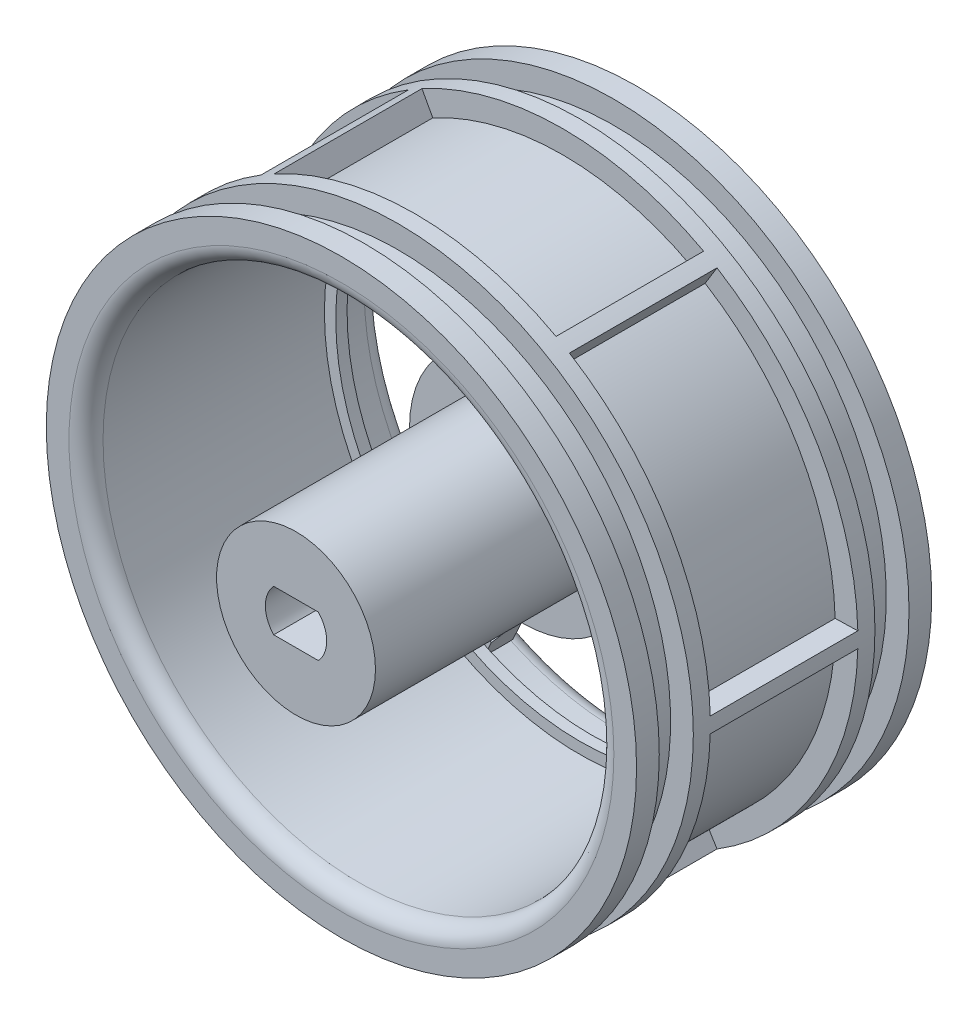
from build123d import *
from build123d.topology import SkipClean

# Parameters (mm, degrees)
CROQUIS5_W               = 1
CROQUIS5_H               = 1
CROQUIS6_W               = 13
CROQUIS6_H               = 2
CORTAR_REVOLUCI_N1_ANGLE = 57
MATRIZC1_COUNT           = 6
SALIENTE_EXTRUIR1_DEPTH  = 1.5
MATRIZC2_COUNT           = 5
REDONDEO2_R              = 5
CROQUIS9_R               = 10
SALIENTE_EXTRUIR2_DEPTH  = 8.5
CROQUIS10_R              = 9
CORTAR_EXTRUIR1_DEPTH    = 4
CROQUIS11_R              = 7
SALIENTE_EXTRUIR3_DEPTH  = 20
REVOLUCI_N3_ANGLE        = 22
MATRIZC3_COUNT           = 5
CORTAR_EXTRUIR3_START    = -1.5
CROQUIS15_R              = 22.5
CROQUIS15_R_2            = 22.3
CORTAR_EXTRUIR3_DEPTH    = 1.5
REDONDEO3_R              = 1.5
REDONDEO4_R              = 2
CORTAR_EXTRUIR2_DEPTH    = 20
CROQUIS16_R              = 5
SALIENTE_EXTRUIR4_DEPTH  = 2
REDONDEO6_R              = 0.5
CROQUIS17_R              = 0.75
SALIENTE_EXTRUIR5_DEPTH  = 2.5
SALIENTE_EXTRUIR5_TAPER  = 4
MATRIZC4_COUNT           = 4
REDONDEO7_R              = 2


# Some blends are built 0.0001 mm under size
with BuildPart() as part:
    # Croquis1 → Revolución1 (revolve)
    with BuildSketch(Plane(origin=(0, 0, 0), x_dir=(0, 0, -1), z_dir=(1, 0, 0)), mode=Mode.PRIVATE) as revoluci_n1_sk:
        Polygon((-13, 22.5), (-13, 26), (-11, 26), (-11, 24), (-8, 24), (-8, 26), (0, 26), (0, 22.5), align=None)
    revoluci_n1 = revolve(revoluci_n1_sk.sketch.rotate(Axis((0, 0, -0.65), (0, 0, 1)), 90), axis=Axis((0, 0, -0.65), (0, 0, 1)))

    # Simetría1: Revolución1 across plane
    add(revoluci_n1.mirror(Plane.XY))

    # Croquis5 → Revolución2 (revolve)
    with BuildSketch(Plane(origin=(0, 0, 0), x_dir=(0, 0, -1), z_dir=(1, 0, 0)), mode=Mode.PRIVATE) as revoluci_n2_sk:
        with Locations((8.5, 22)):
            Rectangle(CROQUIS5_W, CROQUIS5_H)
    revolve(revoluci_n2_sk.sketch.rotate(Axis((0, 0, -0.65), (0, 0, 1)), 90), axis=Axis((0, 0, -0.65), (0, 0, 1)))

    # Croquis6 → Cortar-Revolución1 (revolve, symmetric, cut)
    with BuildSketch(Plane(origin=(0, 0, 0), x_dir=(0, 0, -1), z_dir=(1, 0, 0))) as cortar_revoluci_n1_sk:
        with Locations((0, 25)):
            Rectangle(CROQUIS6_W, CROQUIS6_H)
    cortar_revoluci_n1 = revolve(axis=Axis((0, 0, -0.65), (0, 0, 1)), revolution_arc=CORTAR_REVOLUCI_N1_ANGLE / 2, mode=Mode.SUBTRACT)
    cortar_revoluci_n1 = cortar_revoluci_n1 + revolve(cortar_revoluci_n1_sk.sketch, axis=Axis((0, 0, -0.65), (0, 0, -1)), revolution_arc=CORTAR_REVOLUCI_N1_ANGLE / 2, mode=Mode.SUBTRACT)

    # MatrizC1: Cortar-Revolución1 ×6 about axis
    matrizc1_axis = Axis((0, 0, 0), (0, 0, 1))
    for i in range(1, MATRIZC1_COUNT):
        add(cortar_revoluci_n1.rotate(matrizc1_axis, i * 360 / MATRIZC1_COUNT), mode=Mode.SUBTRACT)

    # Croquis8 → Saliente-Extruir1 (add)
    with BuildSketch(Plane(origin=(0, 0, -13), x_dir=(-1, 0, 0), z_dir=(0, 0, -1))):
        Polygon((-4.421987, 0), (4.421987, 0), (3.5, 24), (-3.5, 24), align=None)
    saliente_extruir1 = extrude(amount=-SALIENTE_EXTRUIR1_DEPTH)

    # MatrizC2: Saliente-Extruir1 ×5 about axis
    matrizc2_axis = Axis((0, 0, 0), (0, 0, 1))
    for i in range(1, MATRIZC2_COUNT):
        add(saliente_extruir1.rotate(matrizc2_axis, i * 360 / MATRIZC2_COUNT))

    # Redondeo2
    redondeo2_edges = [part.edges().sort_by_distance(p)[0] for p in [
        (-4.199915382, 5.7806876, -12.25),
        (4.199915382, 5.7806876, -12.25),
        (-6.795605838, -2.208026185, -12.25),
        (0, -7.14532283, -12.25),
        (6.795605838, -2.208026185, -12.25),
    ]]
    fillet(redondeo2_edges, radius=REDONDEO2_R)

    # Croquis9 → Saliente-Extruir2 (add)
    with BuildSketch(Plane.XY.offset(-11.5)):
        with Locations(Location((0, 0, 0), (0, 0, 180))):
            Circle(CROQUIS9_R)
    extrude(amount=SALIENTE_EXTRUIR2_DEPTH)

    # Croquis10 → Cortar-Extruir1 (cut)
    with BuildSketch(Plane(origin=(0, 0, -13), x_dir=(-1, 0, 0), z_dir=(0, 0, -1))):
        Circle(CROQUIS10_R)
    extrude(amount=-CORTAR_EXTRUIR1_DEPTH, mode=Mode.SUBTRACT)

    # Croquis11 → Saliente-Extruir3 (add)
    with BuildSketch(Plane.XY.offset(-3)):
        Circle(CROQUIS11_R)
    extrude(amount=SALIENTE_EXTRUIR3_DEPTH)

    # Croquis14 → Revolución3 (revolve, symmetric)
    with BuildSketch(Plane(origin=(0, 0, 0), x_dir=(0, 0, -1), z_dir=(1, 0, 0))) as revoluci_n3_sk:
        with BuildLine():
            Line((9, 22.3), (11.5, 22.3))
            Line((11.5, 22.3), (11.5, 19.3))
            ThreePointArc((11.5, 19.3), (10.361757936, 20.236263226), (9, 20.8))
            Line((9, 20.8), (9, 22.3))
        make_face()
    revoluci_n3 = revolve(axis=Axis((0, 0, -0.65), (0, 0, 1)), revolution_arc=REVOLUCI_N3_ANGLE / 2)
    revoluci_n3 = revoluci_n3 + revolve(revoluci_n3_sk.sketch, axis=Axis((0, 0, -0.65), (0, 0, -1)), revolution_arc=REVOLUCI_N3_ANGLE / 2)

    # MatrizC3: Revolución3 ×5 about axis
    matrizc3_axis = Axis((0, 0, 0), (0, 0, 1))
    for i in range(1, MATRIZC3_COUNT):
        add(revoluci_n3.rotate(matrizc3_axis, i * 360 / MATRIZC3_COUNT))

    # Croquis15 → Cortar-Extruir3 (cut)
    with SkipClean():  # the faces are left unmerged after this step: merging them gives an invalid solid
        with BuildSketch(Plane(origin=(0, 0, -13), x_dir=(-1, 0, 0), z_dir=(0, 0, -1)).offset(CORTAR_EXTRUIR3_START)):
            Circle(CROQUIS15_R)
            Circle(CROQUIS15_R_2, mode=Mode.SUBTRACT)
        extrude(amount=CORTAR_EXTRUIR3_DEPTH, mode=Mode.SUBTRACT)

    # Redondeo3
    redondeo3_edges = [part.edges().sort_by_distance(p)[0] for p in [
        (22.5, 0, 13),
        (-20.796730424, -8.58754934, -13),
    ]]
    fillet(redondeo3_edges, radius=REDONDEO3_R - 0.0001)  # a hair under: the kernel refuses the full size

    # Redondeo4
    # the kernel refuses this fillet: 2 mm, written as the material it takes off along each edge
    with BuildSketch(Plane(origin=(0, 0, -13), x_dir=(-0.3758289400897, 0.9266890566911065, 0), z_dir=(-0.9266890566911065, -0.3758289400897, 0))) as redondeo4_piece_1:
        with BuildLine():
            CenterArc((22.3 - REDONDEO4_R, -REDONDEO4_R), REDONDEO4_R, 0, 90)
            Line((22.3 - REDONDEO4_R, 0), (22.3, 0))
            Line((22.3, 0), (22.3, -REDONDEO4_R))
        make_face()
    revolve(axis=Axis((0, 0, -13), (0, 0, -1)), revolution_arc=44.151111319, mode=Mode.SUBTRACT)
    with BuildSketch(Plane(origin=(0, 0, -13), x_dir=(-0.9974711954111269, -0.07107189546576846, 0), z_dir=(0.07107189546576846, -0.9974711954111269, 0))) as redondeo4_piece_2:
        with BuildLine():
            CenterArc((22.3 - REDONDEO4_R, -REDONDEO4_R), REDONDEO4_R, 0, 90)
            Line((22.3 - REDONDEO4_R, 0), (22.3, 0))
            Line((22.3, 0), (22.3, -REDONDEO4_R))
        make_face()
    revolve(axis=Axis((0, 0, -13), (0, 0, -1)), revolution_arc=44.151111319, mode=Mode.SUBTRACT)
    with BuildSketch(Plane(origin=(0, 0, -13), x_dir=(-0.2406421614733374, -0.970613903733838, 0), z_dir=(0.970613903733838, -0.2406421614733374, 0))) as redondeo4_piece_3:
        with BuildLine():
            CenterArc((22.3 - REDONDEO4_R, -REDONDEO4_R), REDONDEO4_R, 0, 90)
            Line((22.3 - REDONDEO4_R, 0), (22.3, 0))
            Line((22.3, 0), (22.3, -REDONDEO4_R))
        make_face()
    revolve(axis=Axis((0, 0, -13), (0, 0, -1)), revolution_arc=44.151111319, mode=Mode.SUBTRACT)
    with BuildSketch(Plane(origin=(0, 0, -13), x_dir=(0.8487461604943658, -0.5288004869949273, 0), z_dir=(0.5288004869949273, 0.8487461604943658, 0))) as redondeo4_piece_4:
        with BuildLine():
            CenterArc((22.3 - REDONDEO4_R, -REDONDEO4_R), REDONDEO4_R, 0, 90)
            Line((22.3 - REDONDEO4_R, 0), (22.3, 0))
            Line((22.3, 0), (22.3, -REDONDEO4_R))
        make_face()
    revolve(axis=Axis((0, 0, -13), (0, 0, -1)), revolution_arc=44.151111319, mode=Mode.SUBTRACT)
    with BuildSketch(Plane(origin=(0, 0, -13), x_dir=(0.7651961364798484, 0.6437972295034462, 0), z_dir=(-0.6437972295034462, 0.7651961364798484, 0))) as redondeo4_piece_5:
        with BuildLine():
            CenterArc((22.3 - REDONDEO4_R, -REDONDEO4_R), REDONDEO4_R, 0, 90)
            Line((22.3 - REDONDEO4_R, 0), (22.3, 0))
            Line((22.3, 0), (22.3, -REDONDEO4_R))
        make_face()
    revolve(axis=Axis((0, 0, -13), (0, 0, -1)), revolution_arc=44.151111319, mode=Mode.SUBTRACT)

    # Croquis12 → Cortar-Extruir2 (cut)
    with BuildSketch(Plane.XY.offset(17)):
        with BuildLine():
            Line((-1.966596044, 1.85), (1.966596044, 1.85))
            ThreePointArc((1.966596044, 1.85), (2.7, 0), (1.966596044, -1.85))
            Line((1.966596044, -1.85), (-1.966596044, -1.85))
            ThreePointArc((-1.966596044, -1.85), (-2.7, 0), (-1.966596044, 1.85))
        make_face()
    extrude(amount=-CORTAR_EXTRUIR2_DEPTH, mode=Mode.SUBTRACT)

    # Croquis16 → Saliente-Extruir4 (add)
    with BuildSketch(Plane(origin=(0, 0, -9), x_dir=(-1, 0, 0), z_dir=(0, 0, -1))):
        Circle(CROQUIS16_R)
    extrude(amount=SALIENTE_EXTRUIR4_DEPTH)

    # Redondeo6
    redondeo6_edges = [part.edges().sort_by_distance(p)[0] for p in [
        (5, 0, -11),
    ]]
    fillet(redondeo6_edges, radius=REDONDEO6_R)

    # Croquis17 → Saliente-Extruir5 (add)
    with BuildSketch(Plane(origin=(0, 0, -9), x_dir=(-1, 0, 0), z_dir=(0, 0, -1))):
        with Locations((-5, 5)):
            Circle(CROQUIS17_R)
    saliente_extruir5 = extrude(amount=SALIENTE_EXTRUIR5_DEPTH, taper=SALIENTE_EXTRUIR5_TAPER)

    # MatrizC4: Saliente-Extruir5 ×4 about axis
    matrizc4_axis = Axis((0, 0, 0), (0, 0, 1))
    for i in range(1, MATRIZC4_COUNT):
        add(saliente_extruir5.rotate(matrizc4_axis, i * 360 / MATRIZC4_COUNT))

    # Redondeo7
    # the kernel refuses this fillet: 2 mm, written as the material it adds along each edge
    with BuildSketch(Plane(origin=(0, 0, -9), x_dir=(-1, 0, 0), z_dir=(0, -1, 0))) as redondeo7_piece_1:
        with BuildLine():
            CenterArc((7.0001, 1.9999), REDONDEO7_R, 270, 90)
            Line((9.0001, 1.9999), (9.0401, 1.9999))
            ThreePointArc((9.0401, 1.9999), (9.04, 0.99995), (9.04, 0))
            Line((9.04, 0), (9, -0.04))
            ThreePointArc((9, -0.04), (8.00005, -0.04), (7.0001, -0.0401))
            Line((7.0001, -0.0401), (7.0001, -0.0001))
        make_face()
    revolve(axis=Axis((0, 0, -9), (0, 0, -1)))


solid = part.part
